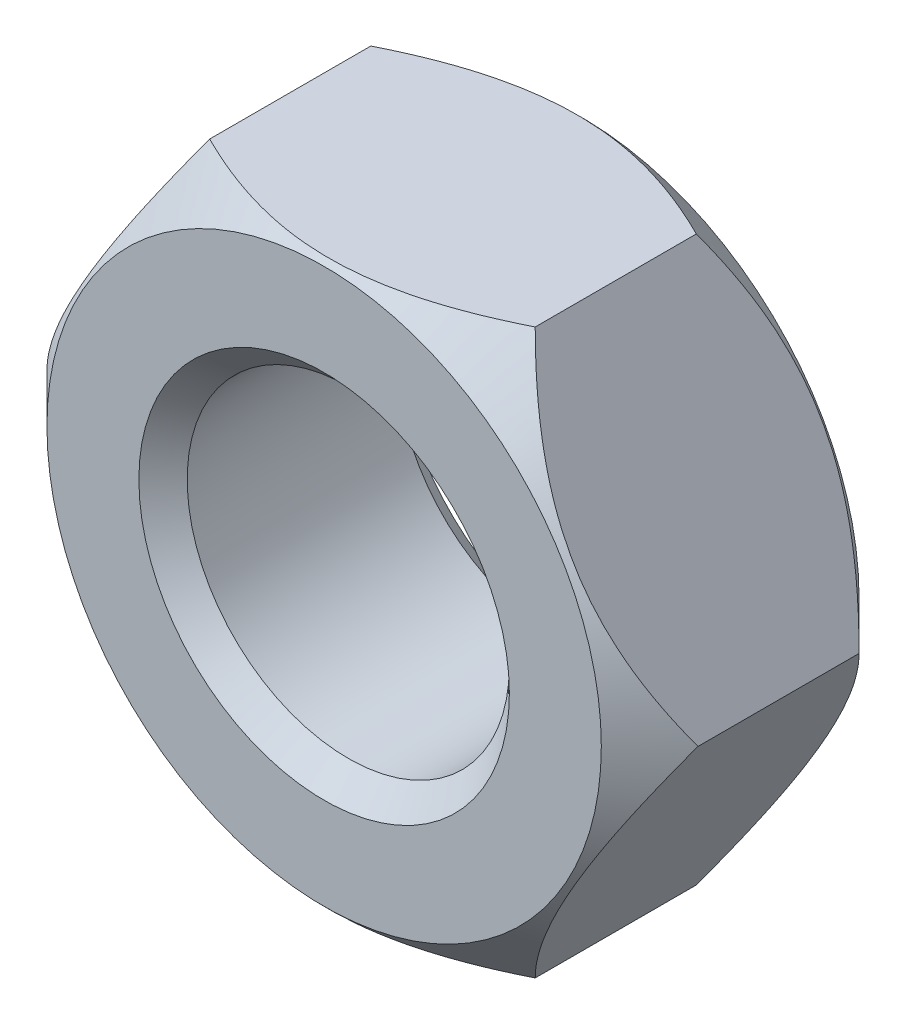
from build123d import *

# Parameters (mm, degrees)
SKETCH1_R           = 4.041451884
BOSS_EXTRUDE1_DEPTH = 1.6
CHAMFER1_SIZE       = 0.6
SKETCH2_R           = 2
CUT_EXTRUDE1_DEPTH  = 7.550318058
CHAMFER2_SIZE       = 0.3


with BuildPart() as part:
    # Sketch1 → Boss-Extrude1 (new, symmetric)
    with BuildSketch(Plane.XY):
        Circle(SKETCH1_R)
    extrude(amount=BOSS_EXTRUDE1_DEPTH, both=True)

    # Chamfer1
    chamfer1_edges = [part.edges().sort_by_distance(p)[0] for p in [
        (-4.041451884, 0, 1.6),
        (-4.041451884, 0, -1.6),
    ]]
    chamfer(chamfer1_edges, length=CHAMFER1_SIZE)

    # Sketch2 → Cut-Extrude1 (cut, through all)
    with BuildSketch(Plane.XY.offset(1.6)):
        with BuildLine():
            ThreePointArc((4.041451884, 0), (3.5, 2.020725942), (2.020725942, 3.5))
            Line((2.020725942, 3.5), (4.041451884, 0))
        make_face()
        with BuildLine():
            Line((-2.020725942, 3.5), (2.020725942, 3.5))
            ThreePointArc((2.020725942, 3.5), (0, 4.041451884), (-2.020725942, 3.5))
        make_face()
        with BuildLine():
            Line((-4.041451884, 0), (-2.020725942, 3.5))
            ThreePointArc((-2.020725942, 3.5), (-3.5, 2.020725942), (-4.041451884, 0))
        make_face()
        with BuildLine():
            ThreePointArc((2.020725942, -3.5), (3.5, -2.020725942), (4.041451884, 0))
            Line((4.041451884, 0), (2.020725942, -3.5))
        make_face()
        with BuildLine():
            Line((-2.020725942, -3.5), (-4.041451884, 0))
            ThreePointArc((-4.041451884, 0), (-3.5, -2.020725942), (-2.020725942, -3.5))
        make_face()
        with BuildLine():
            ThreePointArc((-2.020725942, -3.5), (0, -4.041451884), (2.020725942, -3.5))
            Line((2.020725942, -3.5), (-2.020725942, -3.5))
        make_face()
        Circle(SKETCH2_R)
    extrude(amount=-CUT_EXTRUDE1_DEPTH, mode=Mode.SUBTRACT)

    # Chamfer2
    chamfer2_edges = [part.edges().sort_by_distance(p)[0] for p in [
        (-2, 0, 1.6),
        (-2, 0, -1.6),
    ]]
    chamfer(chamfer2_edges, length=CHAMFER2_SIZE)


solid = part.part
